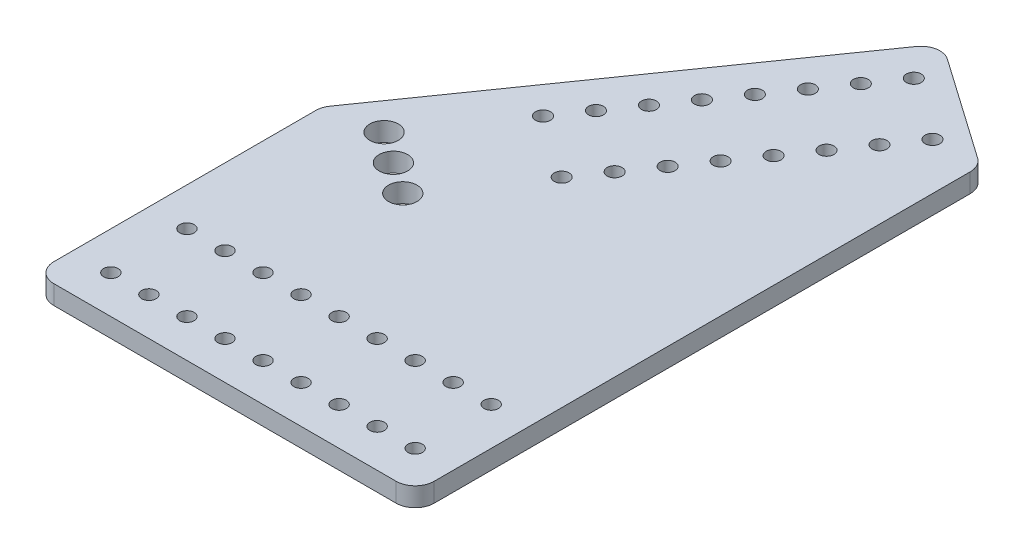
from build123d import *

# Parameters (mm, degrees)
BOSS_EXTRUDE1_DEPTH = 6.35
SKETCH2_R           = 2.413
SKETCH2_R_2         = 2.4892
SKETCH2_R_3         = 4.7625
CUT_EXTRUDE1_DEPTH  = 253.166408591
FILLET1_R           = 6.35


with BuildPart() as part:
    # Sketch1 → Boss-Extrude1 (new body)
    with BuildSketch(Plane(origin=(0, 0, 0), x_dir=(1, 0, 0), z_dir=(0, 1, 0))):
        Polygon((0, 95.812682967), (85.38707615, 217.758065572), (127, 188.620382605), (127, 0), (0, 0), align=None)
    extrude(amount=BOSS_EXTRUDE1_DEPTH)

    # Sketch2 → Cut-Extrude1 (cut, through all)
    with BuildSketch(Plane(origin=(0, 6.35, 0), x_dir=(1, 0, 0), z_dir=(0, 1, 0))):
        with Locations((12.7, 12.7)):
            Circle(SKETCH2_R)
        with Locations((12.7, 38.1)):
            Circle(SKETCH2_R)
        with Locations((25.4, 38.1)):
            Circle(SKETCH2_R)
        with Locations((38.1, 38.1)):
            Circle(SKETCH2_R)
        with Locations((50.8, 38.1)):
            Circle(SKETCH2_R)
        with Locations((63.5, 38.1)):
            Circle(SKETCH2_R)
        with Locations((25.4, 12.7)):
            Circle(SKETCH2_R)
        with Locations((38.1, 12.7)):
            Circle(SKETCH2_R)
        with Locations((50.8, 12.7)):
            Circle(SKETCH2_R)
        with Locations((63.5, 12.7)):
            Circle(SKETCH2_R)
        with Locations((76.2, 12.7)):
            Circle(SKETCH2_R)
        with Locations((76.2, 38.1)):
            Circle(SKETCH2_R)
        with Locations((88.9, 12.7)):
            Circle(SKETCH2_R)
        with Locations((88.9, 38.1)):
            Circle(SKETCH2_R)
        with Locations((101.6, 12.7)):
            Circle(SKETCH2_R)
        with Locations((101.6, 38.1)):
            Circle(SKETCH2_R)
        with Locations((90.531859121, 202.963802812)):
            Circle(SKETCH2_R_2)
        with Locations((111.338321046, 188.394961329)):
            Circle(SKETCH2_R_2)
        with Locations((83.247438379, 192.56057185)):
            Circle(SKETCH2_R_2)
        with Locations((104.053900304, 177.991730366)):
            Circle(SKETCH2_R_2)
        with Locations((75.963017637, 182.157340887)):
            Circle(SKETCH2_R_2)
        with Locations((96.769479562, 167.588499404)):
            Circle(SKETCH2_R_2)
        with Locations((68.678596896, 171.754109925)):
            Circle(SKETCH2_R_2)
        with Locations((89.485058821, 157.185268441)):
            Circle(SKETCH2_R_2)
        with Locations((61.394176154, 161.350878962)):
            Circle(SKETCH2_R_2)
        with Locations((82.200638079, 146.782037479)):
            Circle(SKETCH2_R_2)
        with Locations((54.109755412, 150.947648)):
            Circle(SKETCH2_R_2)
        with Locations((74.916217337, 136.378806516)):
            Circle(SKETCH2_R_2)
        with Locations((46.825334671, 140.544417037)):
            Circle(SKETCH2_R_2)
        with Locations((67.631796596, 125.975575554)):
            Circle(SKETCH2_R_2)
        with Locations((39.540913929, 130.141186075)):
            Circle(SKETCH2_R_2)
        with Locations((60.347375854, 115.572344592)):
            Circle(SKETCH2_R_2)
        with Locations((17.687651704, 98.931493187)):
            Circle(SKETCH2_R_3)
        with Locations((28.090882667, 91.647072446)):
            Circle(SKETCH2_R_3)
        with Locations((38.494113629, 84.362651704)):
            Circle(SKETCH2_R_3)
        with Locations((114.3, 12.7)):
            Circle(SKETCH2_R)
        with Locations((114.3, 38.1)):
            Circle(SKETCH2_R)
    extrude(amount=-CUT_EXTRUDE1_DEPTH, mode=Mode.SUBTRACT)

    # Fillet1
    fillet1_edges = [part.edges().sort_by_distance(p)[0] for p in [
        (85.38707615, 3.175, -217.758065572),
        (127, 3.175, -188.620382605),
        (127, 3.175, 0),
        (0, 3.175, 0),
        (0, 3.175, -95.812682967),
    ]]
    fillet(fillet1_edges, radius=FILLET1_R)


solid = part.part
